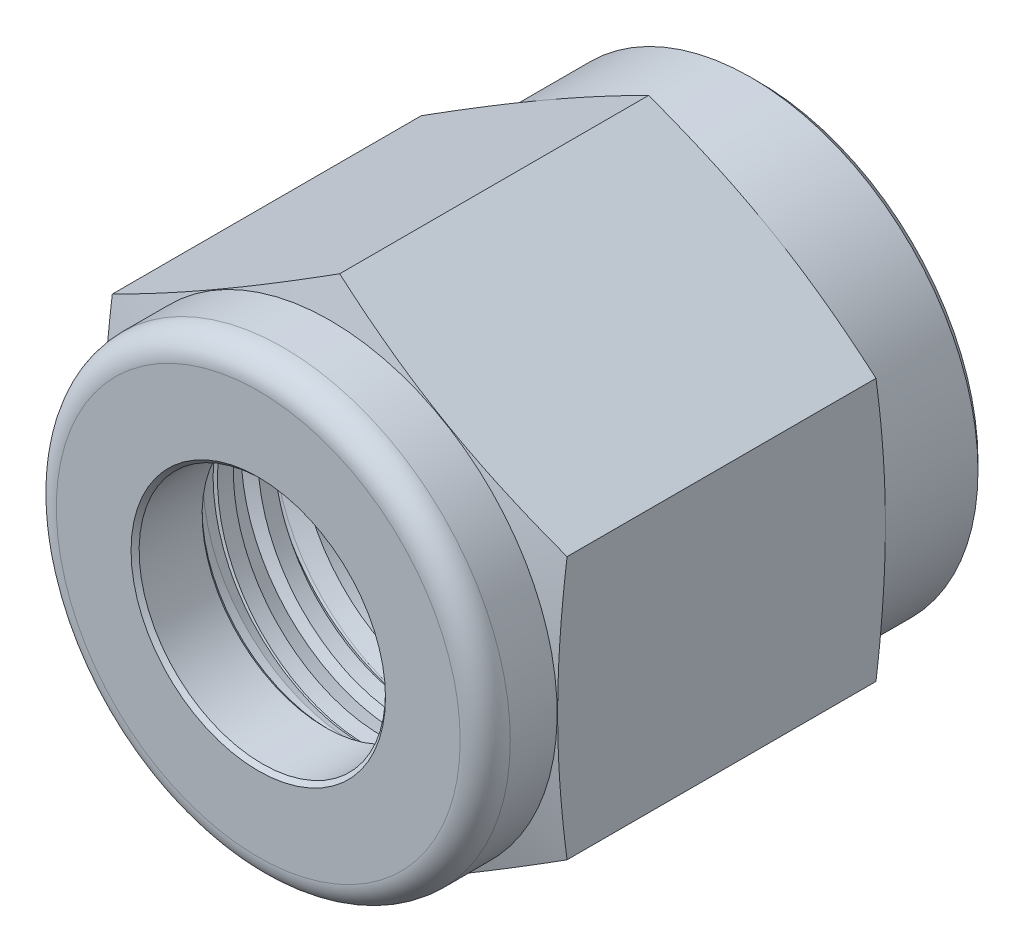
from build123d import *
from build123d.topology import SkipClean

# Parameters (mm, degrees)
BOSS_EXTRUDE1_DEPTH = 15.748
FILLET1_R           = 0.7874
CHAMFER1_SIZE       = 0.254
CHAMFER2_SIZE       = 0.127
CUT_SWEEP1_PITCH    = 1.27


with BuildPart() as part:
    # Sketch1 → Boss-Extrude1 (new body)
    with BuildSketch(Plane.XY):
        Polygon((0, 8.256224319), (-7.1501, 4.12811216), (-7.1501, -4.12811216), (0, -8.256224319), (7.1501, -4.12811216), (7.1501, 4.12811216), align=None)
    extrude(amount=BOSS_EXTRUDE1_DEPTH)

    # Sketch2 → Cut-Revolve1 (revolve, cut)
    with BuildSketch(Plane(origin=(0, 0, 0), x_dir=(0, 0, -1), z_dir=(1, 0, 0))):
        Polygon((-15.748, 9.375048639), (-15.748, 7.1374), (-13.4874, 7.1374), (-13.187611927, 8.256224319), (-3.474788073, 8.256224319), (-3.175, 7.1374), (0, 7.1374), (0, 9.375048639), align=None)
        with BuildLine():
            Line((-15.748, 3.8735), (-15.748, 0))
            Line((-15.748, 0), (0, 0))
            Line((0, 0), (0, 4.782916378))
            Line((0, 4.782916378), (-13.2588, 4.782916378))
            ThreePointArc((-13.2588, 4.782916378), (-13.438405122, 4.7085215), (-13.5128, 4.528916378))
            Line((-13.5128, 4.528916378), (-13.5128, 3.8735))
            Line((-13.5128, 3.8735), (-15.748, 3.8735))
        make_face()
    revolve(axis=Axis((0, 0, 0), (0, 0, 1)), mode=Mode.SUBTRACT)

    # Fillet1
    fillet1_edges = [part.edges().sort_by_distance(p)[0] for p in [
        (0, -7.1374, 15.748),
    ]]
    fillet(fillet1_edges, radius=FILLET1_R)

    # Chamfer1
    chamfer1_edges = [part.edges().sort_by_distance(p)[0] for p in [
        (0, -7.1374, 0),
    ]]
    chamfer(chamfer1_edges, length=CHAMFER1_SIZE)

    # Chamfer2
    chamfer2_edges = [part.edges().sort_by_distance(p)[0] for p in [
        (0, -3.8735, 15.748),
        (0, -3.8735, 13.5128),
    ]]
    chamfer(chamfer2_edges, length=CHAMFER2_SIZE)

    # Cut-Sweep1: the profile of Sketch4 screwed along a right-hand helix of 11 turns, 8 arcs to a turn; built about Z, then put on its axis
    cut_sweep1_z = Axis((0, 0, 0), (0, 0, 1))
    cut_sweep1_corners = [(5.281286934, 0, -0.287734375), (4.568101483, 0, 0.124023437), (4.568101483, 0, -0.897929688), (5.281286934, 0, -0.486171875), (5.338570906, 0, -0.386953125)]
    with BuildLine(mode=Mode.PRIVATE) as cut_sweep1_profile:
        Line(cut_sweep1_corners[0], cut_sweep1_corners[1])
        Line(cut_sweep1_corners[1], cut_sweep1_corners[2])
        Line(cut_sweep1_corners[2], cut_sweep1_corners[3])
        ThreePointArc((5.281286934, 0, -0.486171875), (5.323221712, 0, -0.444237097), (5.338570906, 0, -0.386953125))
        ThreePointArc((5.338570906, 0, -0.386953125), (5.323221712, 0, -0.329669153), (5.281286934, 0, -0.287734375))
    cut_sweep1_cap = Face(cut_sweep1_profile.wire())
    cut_sweep1_arcs = [((5.281286934, 0, -0.486171875), (5.338570906, 0, -0.453098958), (5.338570906, 0, -0.386953125), (1, 0.8660254037844339, 1)), ((5.338570906, 0, -0.386953125), (5.338570906, 0, -0.320807292), (5.281286934, 0, -0.287734375), (1, 0.8660254037844339, 1))]  # start, shoulder, end, weights
    cut_sweep1_turn_angles = [0, 22.5, 45, 67.5, 90, 112.5, 135, 157.5, 180, 202.5, 225, 247.5, 270, 292.5, 315, 337.5, 360]
    cut_sweep1_turn_weights = [1, 0.9238795325112867, 1, 0.9238795325112867, 1, 0.9238795325112867, 1, 0.9238795325112867, 1, 0.9238795325112867, 1, 0.9238795325112867, 1, 0.9238795325112867, 1, 0.9238795325112867, 1]
    cut_sweep1_turn_rails = [Edge.make_bspline([Vector(p[0], p[1], 0).rotate(cut_sweep1_z, cut_sweep1_turn_angles[k]) / cut_sweep1_turn_weights[k] + Vector(0, 0, p[2] + CUT_SWEEP1_PITCH * cut_sweep1_turn_angles[k] / 360) for k in range(17)], [0, 0, 0, 1, 1, 2, 2, 3, 3, 4, 4, 5, 5, 6, 6, 7, 7, 8, 8, 8], 2, cut_sweep1_turn_weights) for p in cut_sweep1_corners]
    cut_sweep1_turn_sides = [*[Face.make_surface_from_curves(cut_sweep1_turn_rails[p[0]], cut_sweep1_turn_rails[p[1]]) for p in [(0, 1), (1, 2), (2, 3)]], *[Face.make_bezier_surface([[Vector(p[j][0], p[j][1], 0).rotate(cut_sweep1_z, cut_sweep1_turn_angles[2 * i + k]) / cut_sweep1_turn_weights[2 * i + k] + Vector(0, 0, p[j][2] + CUT_SWEEP1_PITCH * cut_sweep1_turn_angles[2 * i + k] / 360) for k in range(3)] for j in range(3)], [[p[3][j] * cut_sweep1_turn_weights[2 * i + k] for k in range(3)] for j in range(3)]) for p in cut_sweep1_arcs for i in range(8)]]
    cut_sweep1 = Plane(origin=(0, 0, 0), x_dir=(0, 1, 0), z_dir=(0, 0, 1)) * Solid(Shell([*[p.moved(Location((0, 0, CUT_SWEEP1_PITCH * i))) for i in range(11) for p in cut_sweep1_turn_sides], cut_sweep1_cap, cut_sweep1_cap.rotate(cut_sweep1_z, 3960).moved(Location((0, 0, CUT_SWEEP1_PITCH * 3960 / 360)))]))
    add(cut_sweep1, mode=Mode.SUBTRACT)

    # Cut-Extrude1 cone 1 section (through the dimple's axis) → Cut-Extrude1 (revolve, cut)
    with BuildSketch(Plane.YZ):
        Polygon((0, 0), (5.5626, 0), (0, 5.5626), align=None)
    revolve(axis=Axis((0, 0, 0), (0, 0, 1)), mode=Mode.SUBTRACT)

    # Sketch6 → Revolve1 (revolve)
    with SkipClean():  # the faces are left unmerged after this step: merging them gives an invalid solid
        with BuildSketch(Plane(origin=(0, 0, 0), x_dir=(0, 0, -1), z_dir=(1, 0, 0))):
            Polygon((-13.5128, 5.45313885), (-9.652, 5.45313885), (-12.7, 4.782916378), (-13.5128, 4.782916378), align=None)
        revolve(axis=Axis((0, 0, 0), (0, 0, 1)))


solid = part.part
